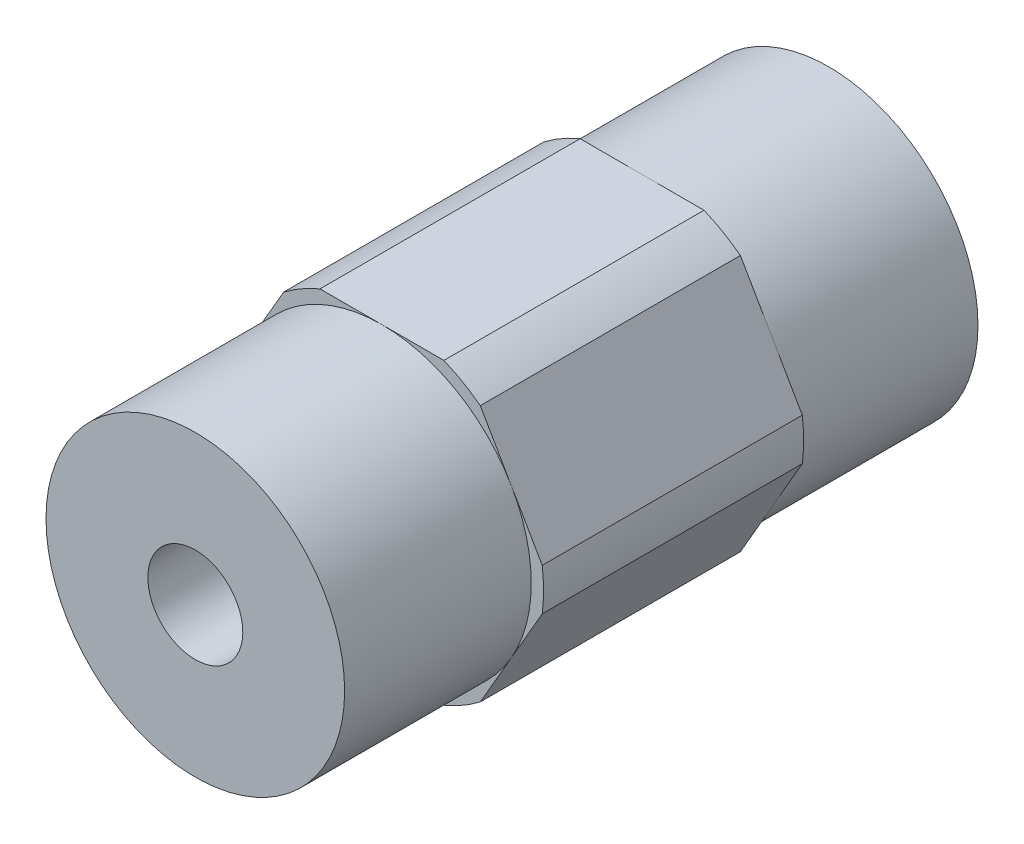
from build123d import *

# Parameters (mm, degrees)
SKETCH1_R                            = 2.0193
BOSS_EXTRUDE1_DEPTH                  = 13.46835
F_10_32_TAPPED_HOLE1_D               = 4.0386
F_10_32_TAPPED_HOLE1_DEPTH           = 11.938
F_10_32_TAPPED_HOLE1_TIP             = 1.213317848
F_10_32_TAPPED_HOLE1_ON_FACE_2_D     = 4.0386
F_10_32_TAPPED_HOLE1_ON_FACE_2_DEPTH = 11.938
F_10_32_TAPPED_HOLE1_ON_FACE_2_TIP   = 1.213317848
SKETCH4_R                            = 8.89
SKETCH4_R_2                          = 6.35
CUT_EXTRUDE_THIN1_DEPTH              = 7.9375


with BuildPart() as part:
    # Sketch1 → Boss-Extrude1 (new, symmetric)
    with BuildSketch(Plane.XY):
        with BuildLine():
            ThreePointArc((6.874999966, 0), (6.860422465, 0.447468582), (6.816751782, 0.893039571))
            Line((6.816751782, 0.893039571), (4.181770846, 5.456960429))
            ThreePointArc((4.181770846, 5.456960429), (3.437499983, 5.953924622), (2.634980936, 6.35))
            Line((2.634980936, 6.35), (-2.634980936, 6.35))
            ThreePointArc((-2.634980936, 6.35), (-3.437499983, 5.953924622), (-4.181770846, 5.456960429))
            Line((-4.181770846, 5.456960429), (-6.816751782, 0.893039571))
            ThreePointArc((-6.816751782, 0.893039571), (-6.874999966, 0), (-6.816751782, -0.893039571))
            Line((-6.816751782, -0.893039571), (-4.181770846, -5.456960429))
            ThreePointArc((-4.181770846, -5.456960429), (-3.437499983, -5.953924622), (-2.634980936, -6.35))
            Line((-2.634980936, -6.35), (2.634980936, -6.35))
            ThreePointArc((2.634980936, -6.35), (3.437499983, -5.953924622), (4.181770846, -5.456960429))
            Line((4.181770846, -5.456960429), (6.816751782, -0.893039571))
            ThreePointArc((6.816751782, -0.893039571), (6.860422465, -0.447468582), (6.874999966, 0))
        make_face()
        Circle(SKETCH1_R, mode=Mode.SUBTRACT)
    extrude(amount=BOSS_EXTRUDE1_DEPTH, both=True)

    # #10-32 Tapped Hole1
    with Locations(Plane.XY.offset(13.46835)):
        with Locations((0, 0)):
            Hole(F_10_32_TAPPED_HOLE1_D / 2, depth=F_10_32_TAPPED_HOLE1_DEPTH)
            with Locations((0, 0, -(F_10_32_TAPPED_HOLE1_DEPTH + F_10_32_TAPPED_HOLE1_TIP / 2))):  # 118° drill point
                Cone(0, F_10_32_TAPPED_HOLE1_D / 2, F_10_32_TAPPED_HOLE1_TIP, mode=Mode.SUBTRACT)

    # #10-32 Tapped Hole1 on face 2
    with Locations(Plane.XY.offset(-13.46835)):
        with Locations((0, 0)):
            Hole(F_10_32_TAPPED_HOLE1_ON_FACE_2_D / 2, depth=F_10_32_TAPPED_HOLE1_ON_FACE_2_DEPTH)
            with Locations((0, 0, -(F_10_32_TAPPED_HOLE1_ON_FACE_2_DEPTH + F_10_32_TAPPED_HOLE1_ON_FACE_2_TIP / 2))):  # 118° drill point
                Cone(0, F_10_32_TAPPED_HOLE1_ON_FACE_2_D / 2, F_10_32_TAPPED_HOLE1_ON_FACE_2_TIP, mode=Mode.SUBTRACT)

    # Sketch4 → Cut-Extrude-Thin1 (cut)
    with BuildSketch(Plane.XY.offset(13.46835)):
        Circle(SKETCH4_R)
        Circle(SKETCH4_R_2, mode=Mode.SUBTRACT)
    cut_extrude_thin1 = extrude(amount=-CUT_EXTRUDE_THIN1_DEPTH, mode=Mode.SUBTRACT)

    # Mirror1: Cut-Extrude-Thin1 across plane
    add(cut_extrude_thin1.mirror(Plane.XY), mode=Mode.SUBTRACT)


solid = part.part
